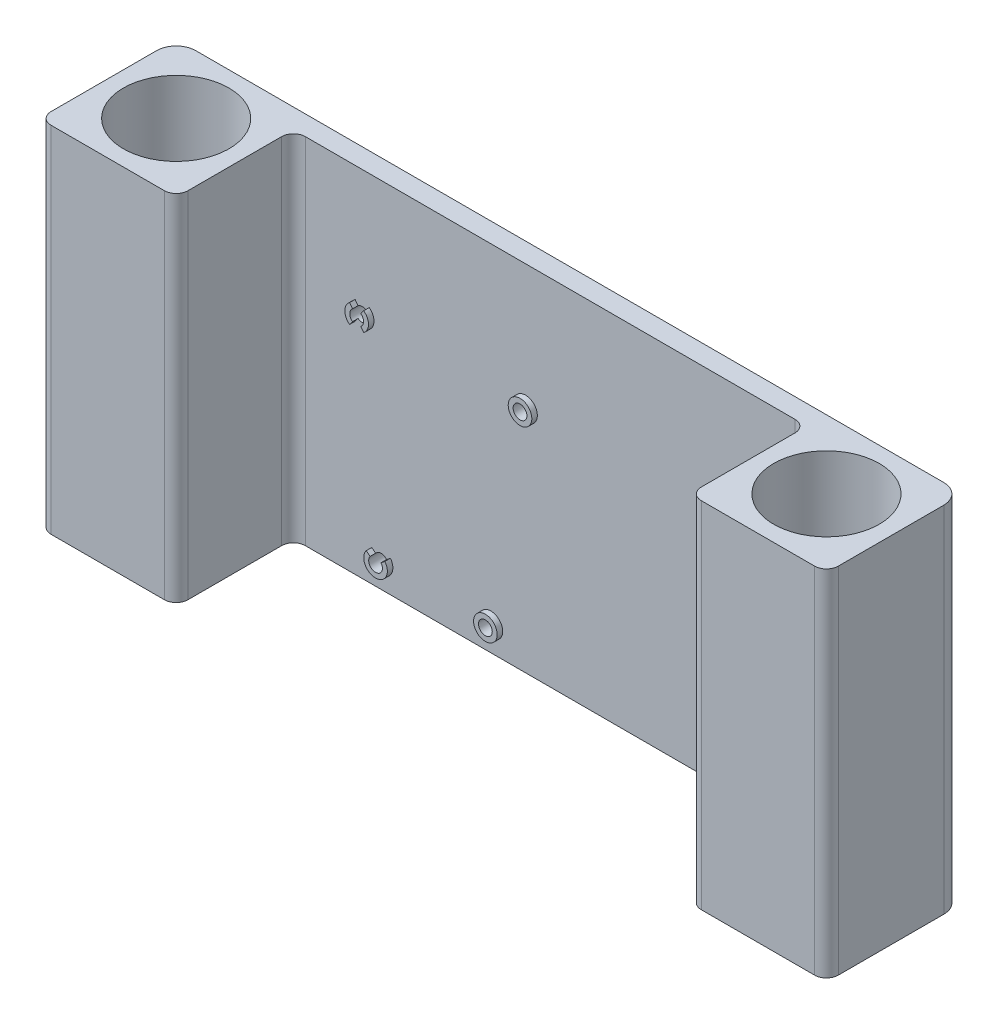
from build123d import *
from build123d.topology import SkipClean

# Parameters (mm, degrees)
SKETCH1_R           = 13.4
BOSS_EXTRUDE1_DEPTH = 90
FILLET1_R           = 5
FILLET2_R           = 3
FILLET3_R           = 3
SKETCH2_R           = 1.75
CUT_EXTRUDE1_DEPTH  = 10
CUT_EXTRUDE3_DEPTH  = 2.5
BOSS_EXTRUDE3_START = 1.4
SKETCH5_R           = 3
SKETCH5_R_2         = 1.75
BOSS_EXTRUDE3_DEPTH = 1.4


with BuildPart() as part:
    # Sketch1 → Boss-Extrude1 (new body)
    with BuildSketch(Plane(origin=(0, 0, 0), x_dir=(1, 0, 0), z_dir=(0, 1, 0))):
        Polygon((17.4, 17.4), (-17.4, 17.4), (-17.4, -17.4), (17.4, -17.4), (17.4, 12.4), (82.6, 12.4), (82.6, 17.4), align=None)
        Circle(SKETCH1_R, mode=Mode.SUBTRACT)
    boss_extrude1 = extrude(amount=BOSS_EXTRUDE1_DEPTH)

    # Mirror3: Boss-Extrude1 across plane
    add(boss_extrude1.mirror(Plane(origin=(82.6, 90, 0), x_dir=(0, 0, 1), z_dir=(1, 0, 0))))

    # Fillet1
    fillet1_edges = [part.edges().sort_by_distance(p)[0] for p in [
        (182.6, 45, -17.4),
        (-17.4, 45, -17.4),
    ]]
    fillet(fillet1_edges, radius=FILLET1_R)

    # Fillet2
    fillet2_edges = [part.edges().sort_by_distance(p)[0] for p in [
        (182.6, 45, 17.4),
        (147.8, 45, 17.4),
        (17.4, 45, 17.4),
        (-17.4, 45, 17.4),
    ]]
    fillet(fillet2_edges, radius=FILLET2_R)

    # Fillet3
    fillet3_edges = [part.edges().sort_by_distance(p)[0] for p in [
        (17.4, 45, -12.4),
        (147.8, 45, -12.4),
    ]]
    fillet(fillet3_edges, radius=FILLET3_R)

    # Sketch2 → Cut-Extrude1 (cut)
    with BuildSketch(Plane.XY.offset(-12.4)):
        with Locations((39.65, 6.197806848)):
            Circle(SKETCH2_R)
        with Locations((67.55, 6.197806848)):
            Circle(SKETCH2_R)
        with Locations((34.85, 58.097806848)):
            Circle(SKETCH2_R)
        with Locations((76.35, 58.097806848)):
            Circle(SKETCH2_R)
    extrude(amount=-CUT_EXTRUDE1_DEPTH, mode=Mode.SUBTRACT)

    # Sketch3 → Cut-Extrude3 (cut)
    with BuildSketch(Plane.XY.offset(-17.4)):
        Polygon((42.940896534, 6.197806848), (41.295448267, 9.047806848), (38.004551733, 9.047806848), (36.359103466, 6.197806848), (38.004551733, 3.347806848), (41.295448267, 3.347806848), align=None)
        Polygon((70.840896534, 6.197806848), (69.195448267, 9.047806848), (65.904551733, 9.047806848), (64.259103466, 6.197806848), (65.904551733, 3.347806848), (69.195448267, 3.347806848), align=None)
        Polygon((79.640896534, 58.097806848), (77.995448267, 60.947806848), (74.704551733, 60.947806848), (73.059103466, 58.097806848), (74.704551733, 55.247806848), (77.995448267, 55.247806848), align=None)
        Polygon((38.140896534, 58.097806848), (36.495448267, 60.947806848), (33.204551733, 60.947806848), (31.559103466, 58.097806848), (33.204551733, 55.247806848), (36.495448267, 55.247806848), align=None)
    extrude(amount=CUT_EXTRUDE3_DEPTH, mode=Mode.SUBTRACT)

    # Sketch5 → Boss-Extrude3 (add)
    # profile 1 of 5: a face of its own
    with SkipClean():  # the faces are left unmerged after this step: merging them gives an invalid solid
        with BuildSketch(Plane.XY.offset(-12.4).offset(BOSS_EXTRUDE3_START)):
            with Locations((67.55, 6.197806848)):
                Circle(SKETCH5_R)
            with Locations((67.55, 6.197806848)):
                Circle(SKETCH5_R_2, mode=Mode.SUBTRACT)
        # profile 2 of 5: a face of its own
        with BuildSketch(Plane.XY.offset(-12.4).offset(BOSS_EXTRUDE3_START)):
            with Locations((76.35, 58.097806848)):
                Circle(SKETCH5_R)
            with Locations((76.35, 58.097806848)):
                Circle(SKETCH5_R_2, mode=Mode.SUBTRACT)
        # profile 3 of 5: a face of its own
        with BuildSketch(Plane.XY.offset(-12.4).offset(BOSS_EXTRUDE3_START)):
            with BuildLine():
                Line((36.641675015, 55.691585611), (35.895143758, 56.694177793))
                ThreePointArc((35.895143758, 56.694177793), (36.6, 58.097806848), (35.895143758, 59.501435903))
                Line((35.895143758, 59.501435903), (36.641675015, 60.504028085))
                ThreePointArc((36.641675015, 60.504028085), (37.85, 58.097806848), (36.641675015, 55.691585611))
            make_face()
        # profile 4 of 5: a face of its own
        with BuildSketch(Plane.XY.offset(-12.4).offset(BOSS_EXTRUDE3_START)):
            with BuildLine():
                Line((33.804856242, 56.694177793), (33.058324985, 55.691585611))
                ThreePointArc((33.058324985, 55.691585611), (31.85, 58.097806848), (33.058324985, 60.504028085))
                Line((33.058324985, 60.504028085), (33.804856242, 59.501435903))
                ThreePointArc((33.804856242, 59.501435903), (33.1, 58.097806848), (33.804856242, 56.694177793))
            make_face()
        # profile 5 of 5: a face of its own
        with BuildSketch(Plane.XY.offset(-12.4).offset(BOSS_EXTRUDE3_START)):
            with BuildLine():
                Line((38.266798429, 7.269839223), (37.278797306, 8.035576634))
                ThreePointArc((37.278797306, 8.035576634), (39.65, 3.197806848), (42.021202694, 8.035576634))
                Line((42.021202694, 8.035576634), (41.033201571, 7.269839223))
                ThreePointArc((41.033201571, 7.269839223), (39.65, 4.447806848), (38.266798429, 7.269839223))
            make_face()
        extrude(amount=-BOSS_EXTRUDE3_DEPTH)


solid = part.part
